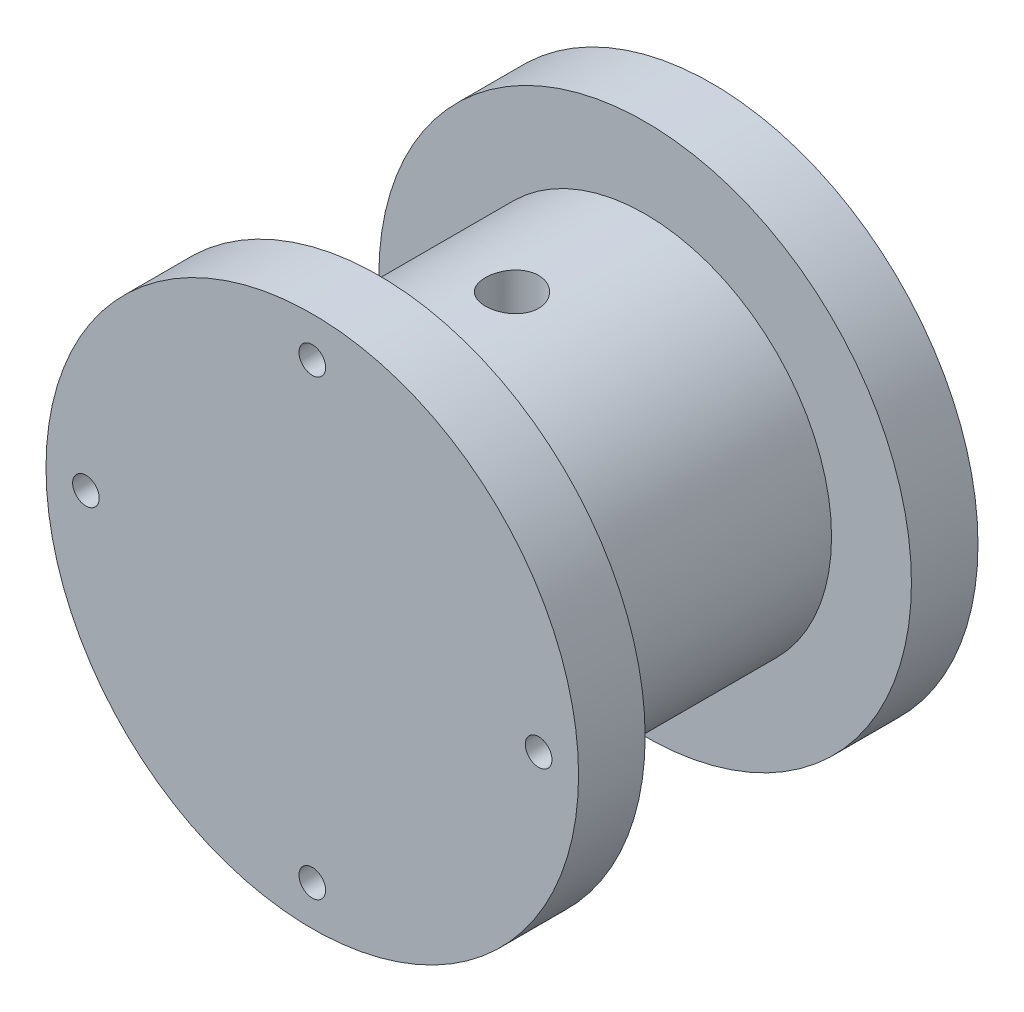
from build123d import *

# Parameters (mm, degrees)
BOSS_EXTRUDE1_DEPTH      = 10
BOSS_EXTRUDE1_DEPTH_BACK = 10
SKETCH1_R                = 14
SKETCH3_R                = 20
BOSS_EXTRUDE2_DEPTH      = 5
CUT_EXTRUDE1_DEPTH       = 36.355339059
CUT_EXTRUDE1_DEPTH_BACK  = 36.355339059
SKETCH4_R                = 2
SKETCH5_R                = 1
CUT_EXTRUDE2_DEPTH       = 38.749172176
CIRPATTERN1_COUNT        = 4
SKETCH6_R                = 3
BOSS_EXTRUDE3_DEPTH      = 7


with BuildPart() as part:
    # Sketch1 → Boss-Extrude1 (new, two sides: drawn at the far end of the back side and taken through both)
    with BuildSketch(Plane.XY.offset(-BOSS_EXTRUDE1_DEPTH_BACK)):
        Circle(SKETCH1_R)
    extrude(amount=BOSS_EXTRUDE1_DEPTH + BOSS_EXTRUDE1_DEPTH_BACK)

    # Sketch3 → Boss-Extrude2 (add)
    with BuildSketch(Plane.XY.offset(10)):
        Circle(SKETCH3_R)
    boss_extrude2 = extrude(amount=BOSS_EXTRUDE2_DEPTH)

    # Mirror1: Boss-Extrude2 across plane
    add(boss_extrude2.mirror(Plane.XY))

    # Sketch4 → Cut-Extrude1 (cut, two sides: drawn at the far end of the back side and taken through both)
    with BuildSketch(Plane(origin=(0, 5, 0), x_dir=(1, 0, 0), z_dir=(0, 1, 0)).offset(-CUT_EXTRUDE1_DEPTH_BACK)):
        Circle(SKETCH4_R)
    extrude(amount=CUT_EXTRUDE1_DEPTH + CUT_EXTRUDE1_DEPTH_BACK, mode=Mode.SUBTRACT)

    # Sketch5 → Cut-Extrude2 (cut, through all)
    with BuildSketch(Plane(origin=(0, 0, 10), x_dir=(-1, 0, 0), z_dir=(0, 0, -1))):
        with Locations((0, 17)):
            Circle(SKETCH5_R)
    cut_extrude2 = extrude(amount=-CUT_EXTRUDE2_DEPTH, mode=Mode.SUBTRACT)

    # CirPattern1: Cut-Extrude2 ×4 about axis
    cirpattern1_axis = Axis((0, 0, -10), (0, 0, 1))
    for i in range(1, CIRPATTERN1_COUNT):
        add(cut_extrude2.rotate(cirpattern1_axis, i * 360 / CIRPATTERN1_COUNT), mode=Mode.SUBTRACT)

    # Sketch6 → Boss-Extrude3 (add)
    with BuildSketch(Plane(origin=(0, 0, -15), x_dir=(-1, 0, 0), z_dir=(0, 0, -1))):
        Circle(SKETCH6_R)
    extrude(amount=BOSS_EXTRUDE3_DEPTH)


solid = part.part
